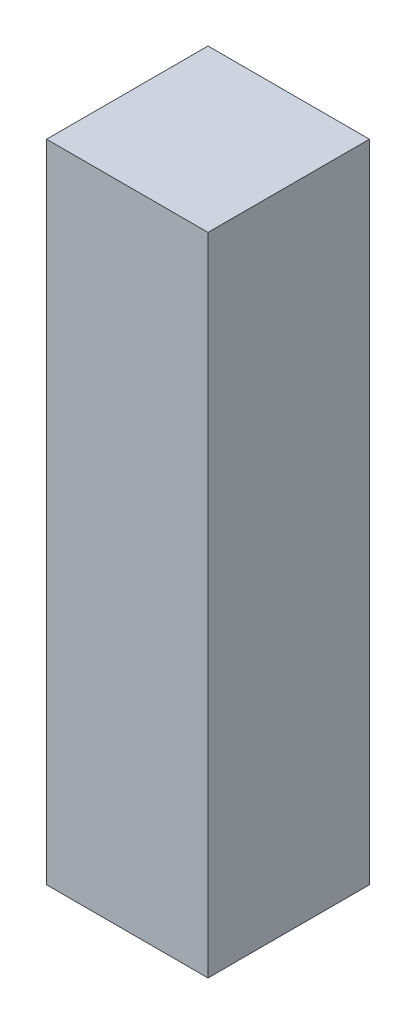
from build123d import *

# Parameters (mm, degrees)
SKETCH1_W           = 12.7
SKETCH1_H           = 12.7
BOSS_EXTRUDE1_DEPTH = 50.8


with BuildPart() as part:
    # Sketch1 → Boss-Extrude1 (new body)
    with BuildSketch(Plane(origin=(0, 0, 0), x_dir=(1, 0, 0), z_dir=(0, 1, 0))):
        Rectangle(SKETCH1_W, SKETCH1_H)
    extrude(amount=BOSS_EXTRUDE1_DEPTH)


solid = part.part
